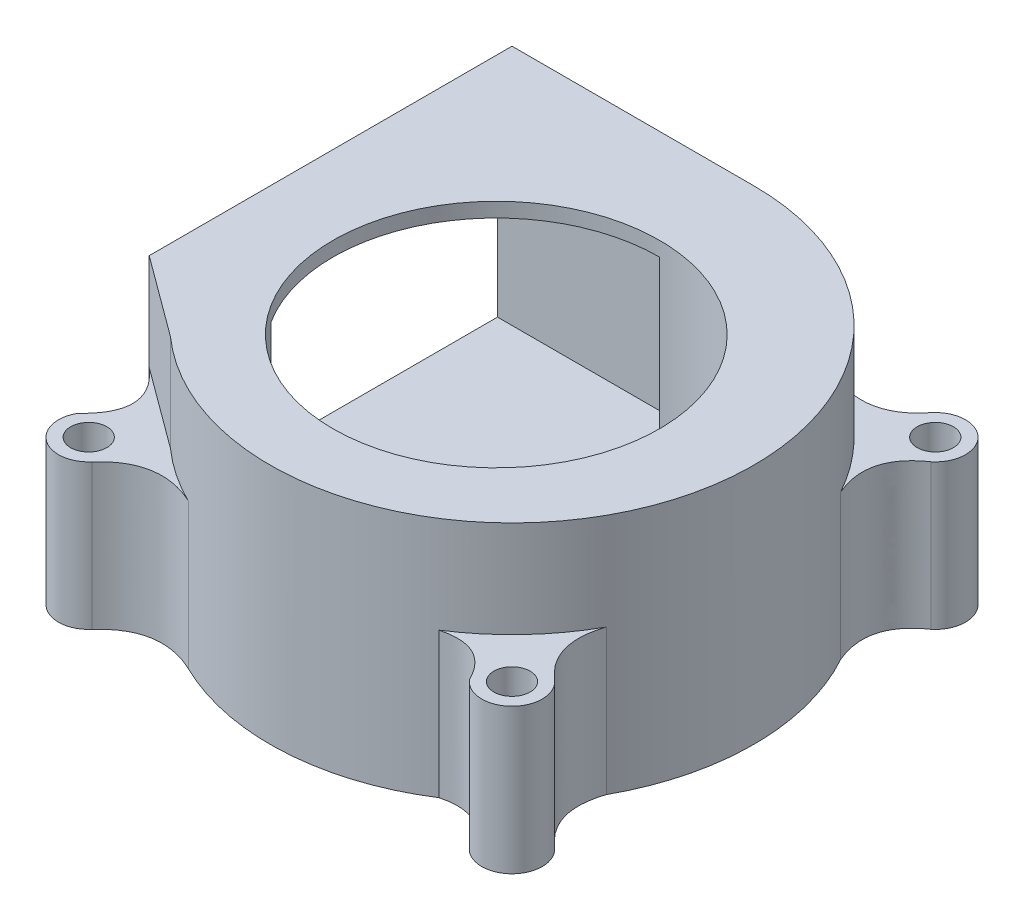
from build123d import *

# Parameters (mm, degrees)
SKETCH_1_W          = 40
SKETCH_1_H          = 40
SKETCH_1_R          = 1.5
EXTRUDE_1_DEPTH     = 20
SKETCH_2_W          = 27.3
SKETCH_2_H          = 17.6
CUT_EXTRUDE_1_DEPTH = 20
SKETCH_3_R          = 13.5
CUT_EXTRUDE_2_DEPTH = 18
SKETCH_4_OUTSIDE_W  = 54
SKETCH_4_OUTSIDE_H  = 54
CUT_EXTRUDE_3_DEPTH = 8
SKETCH_5_OUTSIDE_W  = 54
SKETCH_5_OUTSIDE_H  = 54
CUT_EXTRUDE_4_DEPTH = 58.827329179


with BuildPart() as part:
    # 草图1 → 凸台-拉伸1 (new body)
    with BuildSketch(Plane(origin=(0, 0, 0), x_dir=(1, 0, 0), z_dir=(0, 1, 0))):
        with Locations((20, 20)):
            Rectangle(SKETCH_1_W, SKETCH_1_H)
        with Locations((2.5, 2.5)):
            Circle(SKETCH_1_R, mode=Mode.SUBTRACT)
        with Locations((37.5, 2.5)):
            Circle(SKETCH_1_R, mode=Mode.SUBTRACT)
        with Locations((37.5, 37.5)):
            Circle(SKETCH_1_R, mode=Mode.SUBTRACT)
    extrude(amount=EXTRUDE_1_DEPTH)

    # 草图2 → 切除-拉伸1 (cut)
    with BuildSketch(Plane.ZY):
        with Locations((-25.15, 10)):
            Rectangle(SKETCH_2_W, SKETCH_2_H)
    extrude(amount=-CUT_EXTRUDE_1_DEPTH, mode=Mode.SUBTRACT)

    # 草图3 → 切除-拉伸2 (cut)
    with BuildSketch(Plane(origin=(0, 20, 0), x_dir=(1, 0, 0), z_dir=(0, 1, 0))):
        with Locations((20, 18.7)):
            Circle(SKETCH_3_R)
    extrude(amount=-CUT_EXTRUDE_2_DEPTH, mode=Mode.SUBTRACT)

    # 草图4 outside → 切除-拉伸3 (cut)
    with BuildSketch(Plane(origin=(0, 20, 0), x_dir=(1, 0, 0), z_dir=(0, 1, 0))):
        with Locations((20, 20)):
            Rectangle(SKETCH_4_OUTSIDE_W, SKETCH_4_OUTSIDE_H)
        with BuildLine():
            Line((20, 40), (0, 40))
            Line((0, 40), (0, 20))
            Line((0, 20), (0, 10))
            Line((0, 10), (6.692582543, 5.069740772))
            ThreePointArc((6.692582543, 5.069740772), (38.689638634, 12.879788787), (20, 40))
        make_face(mode=Mode.SUBTRACT)
    extrude(amount=-CUT_EXTRUDE_3_DEPTH, mode=Mode.SUBTRACT)

    # 草图5 outside → 切除-拉伸4 (cut, through all)
    with BuildSketch(Plane(origin=(0, 12, 0), x_dir=(1, 0, 0), z_dir=(0, 1, 0))):
        with Locations((20, 20)):
            Rectangle(SKETCH_5_OUTSIDE_W, SKETCH_5_OUTSIDE_H)
        with BuildLine():
            Line((0, 40), (0, 10))
            add(Edge.make_bspline(
                [(0, 10), (3.638806933, 6.878431862), (0.339826236, 3.758431289)],
                knots=[0, 0, 0, 1, 1, 1], degree=2))
            ThreePointArc((0.339826236, 3.758431289), (1.052952689, 0.461359748), (4.40068463, 0.875993246))
            add(Edge.make_bspline(
                [(11.200276687, 2.039908975), (7.143896711, 3.952452975), (4.40068463, 0.875993246)],
                knots=[0, 0, 0, 1, 1, 1], degree=2))
            ThreePointArc((11.200276687, 2.039908975), (21.144719324, 0.032786432), (30.794624305, 3.163251914))
            add(Edge.make_bspline(
                [(30.794624305, 3.163251914), (34.063948175, 4.035889324), (35.59931537, 0.875993246)],
                knots=[0, 0, 0, 1, 1, 1], degree=2))
            ThreePointArc((35.59931537, 0.875993246), (39.241156707, 0.706017469), (39.180073086, 4.351311542))
            add(Edge.make_bspline(
                [(37.5, 10.317541634), (36.319762019, 6.765651399), (39.180073086, 4.351311542)],
                knots=[0, 0, 0, 1, 1, 1], degree=2))
            ThreePointArc((37.5, 10.317541634), (40, 20), (37.5, 29.682458366))
            add(Edge.make_bspline(
                [(37.5, 29.682458366), (35.925102207, 33.39107959), (39.07643597, 35.559677957)],
                knots=[0, 0, 0, 1, 1, 1], degree=2))
            ThreePointArc((39.07643597, 35.559677957), (39.289523468, 39.245739315), (35.59931537, 39.124006754))
            add(Edge.make_bspline(
                [(29.682458366, 37.5), (33.334347744, 36.215512873), (35.59931537, 39.124006754)],
                knots=[0, 0, 0, 1, 1, 1], degree=2))
            ThreePointArc((29.682458366, 37.5), (25, 39.364916731), (20, 40))
            Line((20, 40), (0, 40))
        make_face(mode=Mode.SUBTRACT)
    extrude(amount=-CUT_EXTRUDE_4_DEPTH, mode=Mode.SUBTRACT)


solid = part.part
